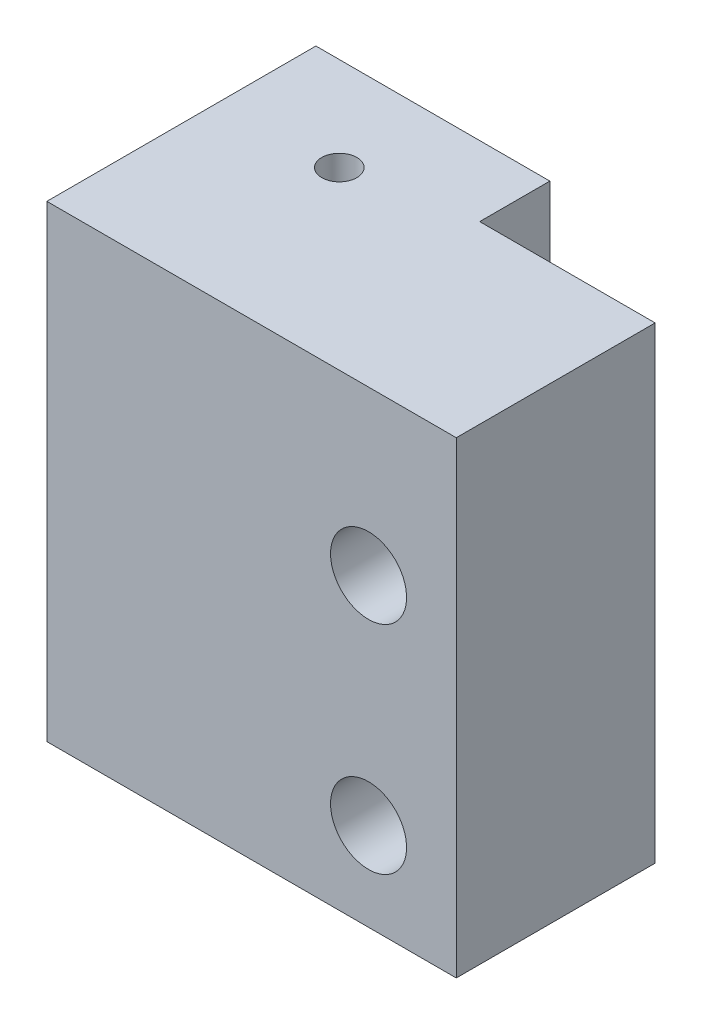
from build123d import *

# Parameters (mm, degrees)
BOSS_EXTRUDE2_DEPTH = 40
SKETCH3_R           = 4
CUT_EXTRUDE1_DEPTH  = 35
CUT_EXTRUDE2_REACH  = 52.14
SKETCH4_R           = 3.25
SKETCH6_R           = 1.5
CUT_EXTRUDE3_DEPTH  = 10


with BuildPart() as part:
    # Sketch1 → Boss-Extrude2 (new body)
    with BuildSketch(Plane(origin=(0, 0, 0), x_dir=(1, 0, 0), z_dir=(0, 1, 0))):
        Polygon((-10, -5.257459708), (-10, 0.742540292), (10, 0.742540292), (10, -5.257459708), (25, -5.257459708), (25, -22.257459708), (-10, -22.257459708), align=None)
    extrude(amount=BOSS_EXTRUDE2_DEPTH)

    # Sketch3 → Cut-Extrude1 (cut)
    with BuildSketch(Plane.XZ):
        with Locations((0, 7.257459708)):
            Circle(SKETCH3_R)
    extrude(amount=-CUT_EXTRUDE1_DEPTH, mode=Mode.SUBTRACT)

    # Sketch4 → Cut-Extrude2 (cut, up to next)
    with BuildSketch(Plane(origin=(0, 0, 5.257459708), x_dir=(-1, 0, 0), z_dir=(0, 0, -1)), mode=Mode.PRIVATE) as cut_extrude2_sk1:
        with Locations((-17.5, 26.045770547)):
            Circle(SKETCH4_R)
    cut_extrude2_tool1 = extrude(cut_extrude2_sk1.sketch, amount=-CUT_EXTRUDE2_REACH, mode=Mode.PRIVATE) & part.part
    # Sketch4 → Cut-Extrude2 (cut, up to next)
    with BuildSketch(Plane(origin=(0, 0, 5.257459708), x_dir=(-1, 0, 0), z_dir=(0, 0, -1)), mode=Mode.PRIVATE) as cut_extrude2_sk2:
        with Locations((-17.5, 7.535290978)):
            Circle(SKETCH4_R)
    cut_extrude2_tool2 = extrude(cut_extrude2_sk2.sketch, amount=-CUT_EXTRUDE2_REACH, mode=Mode.PRIVATE) & part.part
    add(cut_extrude2_tool1.solids().sort_by_distance((17.5, 26.045771, 5.25746))[0], mode=Mode.SUBTRACT)
    add(cut_extrude2_tool2.solids().sort_by_distance((17.5, 7.535291, 5.25746))[0], mode=Mode.SUBTRACT)

    # Sketch6 → Cut-Extrude3 (cut)
    with BuildSketch(Plane.XZ.offset(-35)):
        with Locations((0, 7.257459708)):
            Circle(SKETCH6_R)
    extrude(amount=-CUT_EXTRUDE3_DEPTH, mode=Mode.SUBTRACT)


solid = part.part
